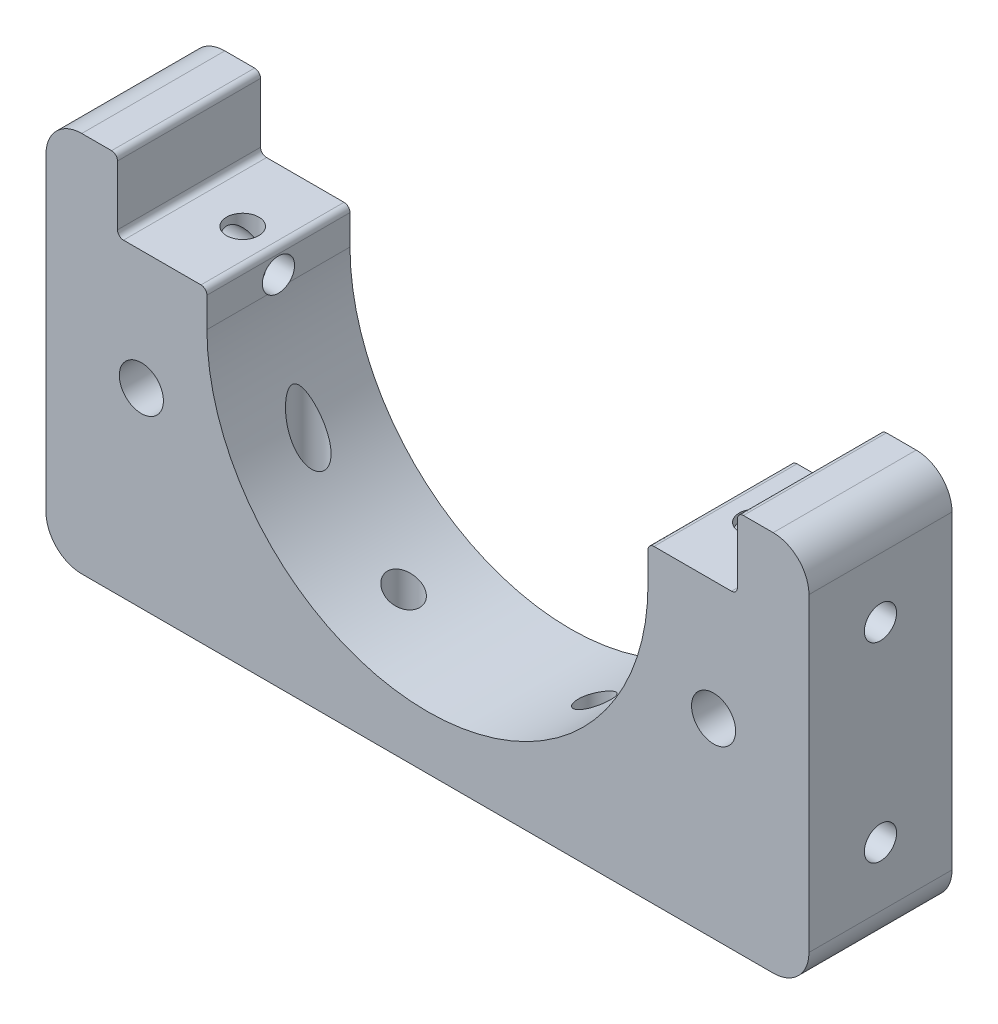
from build123d import *

# Parameters (mm, degrees)
SKETCH1_W                  = 64
SKETCH1_H                  = 32
BOSS_EXTRUDE1_DEPTH        = 12
CUT_EXTRUDE1_DEPTH         = 43.941821107
SKETCH3_W                  = 7.5
SKETCH3_H                  = 6
CUT_EXTRUDE2_DEPTH         = 43.941821107
M2_5_CLEARANCE_HOLE1_D     = 2.7051
M2_5_CLEARANCE_HOLE1_DEPTH = 32
M2_5_CLEARANCE_HOLE2_D     = 2.7051
M2_5_CLEARANCE_HOLE2_DEPTH = 32
F_3_7_3_7_DIAMETER_HOLE1_D = 3.7
M2_5_CLEARANCE_HOLE3_D     = 2.7051
M2_5_CLEARANCE_HOLE3_DEPTH = 12
M2_5_CLEARANCE_HOLE3_TIP   = 0.560244554
F_3_7_3_7_DIAMETER_HOLE2_D = 3.7
M2_5_CLEARANCE_HOLE4_D     = 2.7051
M2_5_CLEARANCE_HOLE4_DEPTH = 74.5
M2_5_CLEARANCE_HOLE5_D     = 2.7051
M2_5_CLEARANCE_HOLE5_DEPTH = 10.5
M2_5_CLEARANCE_HOLE5_TIP   = 0.560244554
M2_5_CLEARANCE_HOLE6_D     = 2.7051
M2_5_CLEARANCE_HOLE6_DEPTH = 10.5
M2_5_CLEARANCE_HOLE6_TIP   = 0.560244554
FILLET1_R                  = 0.5
FILLET2_R                  = 3


with BuildPart() as part:
    # Sketch1 → Boss-Extrude1 (new body)
    with BuildSketch(Plane(origin=(0, 0, -6), x_dir=(-1, 0, 0), z_dir=(0, 0, -1))):
        with Locations((0, -10)):
            Rectangle(SKETCH1_W, SKETCH1_H)
    extrude(amount=-BOSS_EXTRUDE1_DEPTH)

    # Sketch2 → Cut-Extrude1 (cut, through all)
    with BuildSketch(Plane.XY.offset(6)):
        with BuildLine():
            Line((-26, 6), (-26, 0))
            Line((-26, 0), (-18.5, 0))
            Line((-18.5, 0), (-18.5, -3))
            ThreePointArc((-18.5, -3), (0, -21.5), (18.5, -3))
            Line((18.5, -3), (18.5, 6))
            Line((18.5, 6), (-26, 6))
        make_face()
    extrude(amount=-CUT_EXTRUDE1_DEPTH, mode=Mode.SUBTRACT)

    # Sketch3 → Cut-Extrude2 (cut, through all)
    with BuildSketch(Plane.XY.offset(6)):
        with Locations((22.25, 3)):
            Rectangle(SKETCH3_W, SKETCH3_H)
    extrude(amount=-CUT_EXTRUDE2_DEPTH, mode=Mode.SUBTRACT)

    # M2.5 Clearance Hole1
    with Locations(Plane(origin=(0, -26, 0), x_dir=(-1, 0, 0), z_dir=(0, -1, 0))):
        with Locations((8, 0), (-8, 0)):
            Hole(M2_5_CLEARANCE_HOLE1_D / 2, depth=M2_5_CLEARANCE_HOLE1_DEPTH)

    # M2.5 Clearance Hole2
    with Locations(Plane(origin=(0, -26, 0), x_dir=(-1, 0, 0), z_dir=(0, -1, 0))):
        with Locations((16, 0), (-16, 0)):
            Hole(M2_5_CLEARANCE_HOLE2_D / 2, depth=M2_5_CLEARANCE_HOLE2_DEPTH)

    # Ø3.7 (3.7) Diameter Hole1 (through all)
    with Locations(Plane(origin=(0, 0, -6), x_dir=(-1, 0, 0), z_dir=(0, 0, -1))):
        with Locations((24, -10)):
            Hole(F_3_7_3_7_DIAMETER_HOLE1_D / 2)

    # M2.5 Clearance Hole3
    with Locations(Plane(origin=(0, 0, 0), x_dir=(1, 0, 0), z_dir=(0, 1, 0))):
        with Locations((21.5, 0), (-21.5, 0)):
            Hole(M2_5_CLEARANCE_HOLE3_D / 2, depth=M2_5_CLEARANCE_HOLE3_DEPTH)
            with Locations((0, 0, -(M2_5_CLEARANCE_HOLE3_DEPTH + M2_5_CLEARANCE_HOLE3_TIP / 2))):  # 135° drill point
                Cone(0, M2_5_CLEARANCE_HOLE3_D / 2, M2_5_CLEARANCE_HOLE3_TIP, mode=Mode.SUBTRACT)

    # Ø3.7 (3.7) Diameter Hole2 (through all)
    with Locations(Plane.XY.offset(6)):
        with Locations((24, -10)):
            Hole(F_3_7_3_7_DIAMETER_HOLE2_D / 2)

    # M2.5 Clearance Hole4
    with Locations(Plane(origin=(32, 0, 0), x_dir=(0, 0, -1), z_dir=(1, 0, 0))):
        with Locations((0, -2)):
            Hole(M2_5_CLEARANCE_HOLE4_D / 2, depth=M2_5_CLEARANCE_HOLE4_DEPTH)

    # M2.5 Clearance Hole5
    with Locations(Plane(origin=(32, 0, 0), x_dir=(0, 0, -1), z_dir=(1, 0, 0))):
        with Locations((0, -18)):
            Hole(M2_5_CLEARANCE_HOLE5_D / 2, depth=M2_5_CLEARANCE_HOLE5_DEPTH)
            with Locations((0, 0, -(M2_5_CLEARANCE_HOLE5_DEPTH + M2_5_CLEARANCE_HOLE5_TIP / 2))):  # 135° drill point
                Cone(0, M2_5_CLEARANCE_HOLE5_D / 2, M2_5_CLEARANCE_HOLE5_TIP, mode=Mode.SUBTRACT)

    # M2.5 Clearance Hole6
    with Locations(Plane.ZY.offset(32)):
        with Locations((0, -18)):
            Hole(M2_5_CLEARANCE_HOLE6_D / 2, depth=M2_5_CLEARANCE_HOLE6_DEPTH)
            with Locations((0, 0, -(M2_5_CLEARANCE_HOLE6_DEPTH + M2_5_CLEARANCE_HOLE6_TIP / 2))):  # 135° drill point
                Cone(0, M2_5_CLEARANCE_HOLE6_D / 2, M2_5_CLEARANCE_HOLE6_TIP, mode=Mode.SUBTRACT)

    # Fillet1
    fillet1_edges = [part.edges().sort_by_distance(p)[0] for p in [
        (-18.5, 0, 0),
        (18.5, 0, 0),
        (26, 6, 0),
        (-26, 0, 0),
        (26, 0, 0),
        (-26, 6, 0),
    ]]
    fillet(fillet1_edges, radius=FILLET1_R)

    # Fillet2
    fillet2_edges = [part.edges().sort_by_distance(p)[0] for p in [
        (-32, 6, 0),
        (32, 6, 0),
        (-32, -26, 0),
        (32, -26, 0),
    ]]
    fillet(fillet2_edges, radius=FILLET2_R)


solid = part.part
